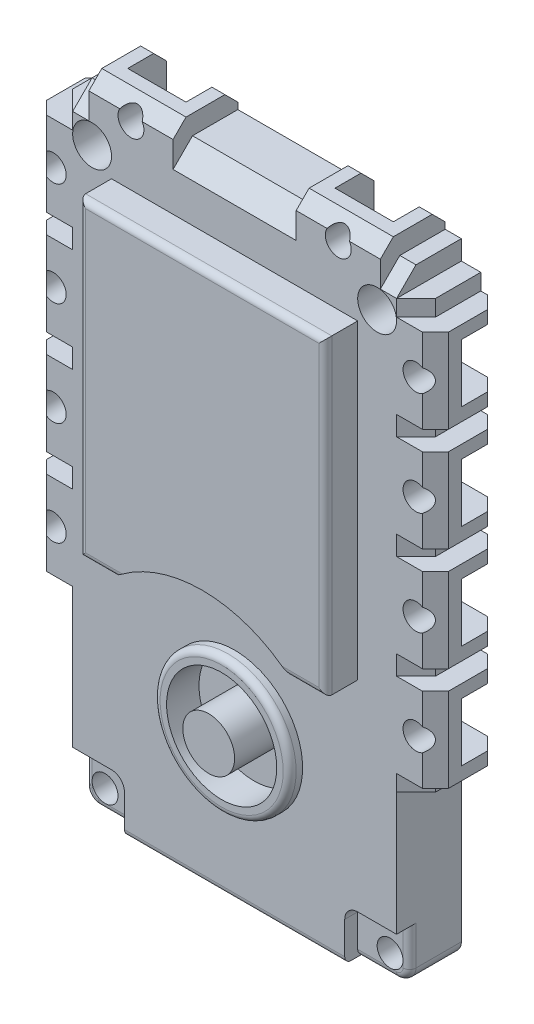
from build123d import *

# Parameters (mm, degrees)
BOSS_EXTRUDE1_DEPTH       = 5
BOSS_EXTRUDE2_DEPTH       = 1
SKETCH3_R                 = 5.25
SKETCH3_R_2               = 2
BOSS_EXTRUDE3_DEPTH       = 1
SKETCH4_R                 = 4.25
CUT_EXTRUDE1_DEPTH        = 0.5
FILLET3_R                 = 0.5
CUT_EXTRUDE2_START        = -11.5
SKETCH5_R                 = 2
CUT_EXTRUDE2_DEPTH        = 11.5
SKETCH6_W                 = 1.5
SKETCH6_H                 = 33
BOSS_EXTRUDE4_DEPTH       = 5
CUT_EXTRUDE3_DEPTH        = 61
SKETCH8_W                 = 3
SKETCH8_H                 = 6.5
SKETCH8_R                 = 1
BOSS_EXTRUDE5_DEPTH       = 5
CUT_EXTRUDE4_DEPTH        = 31
SKETCH10_R                = 1
CUT_EXTRUDE5_DEPTH        = 31
BOSS_EXTRUDE11_DEPTH      = 5
CUT_EXTRUDE6_DEPTH        = 25
SKETCH13_W                = 6.5
SKETCH13_H                = 3
SKETCH13_R                = 1
BOSS_EXTRUDE12_DEPTH      = 5
SKETCH15_R                = 1
CUT_EXTRUDE7_DEPTH        = 5
CUT_EXTRUDE8_DEPTH        = 23
CUT_EXTRUDE10_START       = -3
CUT_EXTRUDE10_OUTLINE_W   = 4.5
CUT_EXTRUDE10_OUTLINE_H   = 3
CUT_EXTRUDE10_OUTLINE_H_2 = 2
CUT_EXTRUDE10_DEPTH       = 3
SKETCH18_W                = 3
SKETCH18_H                = 4.5
CUT_EXTRUDE11_DEPTH       = 3
SKETCH19_W                = 4.5
SKETCH19_H                = 1
CUT_EXTRUDE12_DEPTH       = 3
SKETCH20_W                = 1
SKETCH20_H                = 4.5
SKETCH20_W_2              = 3
CUT_EXTRUDE13_DEPTH       = 3
SKETCH21_W                = 19
SKETCH21_H                = 24
BOSS_EXTRUDE13_DEPTH      = 2.5
SKETCH22_R                = 1.5
SKETCH22_R_2              = 1
CUT_EXTRUDE14_DEPTH       = 16.5
CUT_EXTRUDE15_DEPTH       = 1
SKETCH25_R                = 4.25
CUT_EXTRUDE16_DEPTH       = 2
SKETCH26_R                = 2
BOSS_EXTRUDE14_DEPTH      = 7
CUT_EXTRUDE17_DEPTH       = 1
CUT_EXTRUDE17_DEPTH_BACK  = 2
FILLET5_R                 = 0.5
FILLET6_R                 = 0.5
FILLET7_R                 = 0.5
FILLET8_R                 = 0.5


# Read off the part's stored shape, not the designer's step: Cut-Extrude10
with BuildPart() as part:
    # Sketch1 → Boss-Extrude1 (new body)
    with BuildSketch(Plane.XY):
        with BuildLine():
            Line((18.25, 1.5), (18.25, 0))
            Line((18.25, 0), (24, 0))
            ThreePointArc((24, 0), (24.707106781, -0.292893219), (25, -1))
            Line((25, -1), (25, -45.5))
            ThreePointArc((25, -45.5), (24.707106781, -46.207106781), (24, -46.5))
            Line((24, -46.5), (1, -46.5))
            ThreePointArc((1, -46.5), (0.292893219, -46.207106781), (0, -45.5))
            Line((0, -45.5), (0, -1))
            ThreePointArc((0, -1), (0.292893219, -0.292893219), (1, 0))
            Line((1, 0), (6.75, 0))
            Line((6.75, 0), (6.75, 1.5))
            Line((6.75, 1.5), (18.25, 1.5))
        make_face()
    extrude(amount=BOSS_EXTRUDE1_DEPTH)

    # Sketch2 → Boss-Extrude2 (add)
    with BuildSketch(Plane(origin=(0, 0, 0), x_dir=(-1, 0, 0), z_dir=(0, 0, -1))):
        with BuildLine():
            Line((-24, -2), (-24, -44.5))
            ThreePointArc((-24, -44.5), (-23.707106781, -45.207106781), (-23, -45.5))
            Line((-23, -45.5), (-2, -45.5))
            ThreePointArc((-2, -45.5), (-1.292893219, -45.207106781), (-1, -44.5))
            Line((-1, -44.5), (-1, -2))
            ThreePointArc((-1, -2), (-1.292893219, -1.292893219), (-2, -1))
            Line((-2, -1), (-23, -1))
            ThreePointArc((-23, -1), (-23.707106781, -1.292893219), (-24, -2))
        make_face()
        with BuildLine():
            Line((-23, -3), (-23, -43.5))
            ThreePointArc((-23, -43.5), (-22.707106781, -44.207106781), (-22, -44.5))
            Line((-22, -44.5), (-3, -44.5))
            ThreePointArc((-3, -44.5), (-2.292893219, -44.207106781), (-2, -43.5))
            Line((-2, -43.5), (-2, -3))
            ThreePointArc((-2, -3), (-2.292893219, -2.292893219), (-3, -2))
            Line((-3, -2), (-22, -2))
            ThreePointArc((-22, -2), (-22.707106781, -2.292893219), (-23, -3))
        make_face(mode=Mode.SUBTRACT)
    extrude(amount=BOSS_EXTRUDE2_DEPTH)

    # Sketch3 → Boss-Extrude3 (add)
    with BuildSketch(Plane.XY.offset(5)):
        with Locations(Location((12.5, -35, 0), (0, 0, 180))):
            Circle(SKETCH3_R)
        with Locations((12.5, -35)):
            Circle(SKETCH3_R_2, mode=Mode.SUBTRACT)
    extrude(amount=BOSS_EXTRUDE3_DEPTH)

    # Sketch4 → Cut-Extrude1 (cut)
    with BuildSketch(Plane.XY.offset(6)):
        with Locations((12.5, -35)):
            Circle(SKETCH4_R)
    extrude(amount=-CUT_EXTRUDE1_DEPTH, mode=Mode.SUBTRACT)

    # Fillet3
    fillet3_edges = [part.edges().sort_by_distance(p)[0] for p in [
        (17.75, -35, 6),
    ]]
    fillet(fillet3_edges, radius=FILLET3_R)

    # Sketch5 → Cut-Extrude2 (cut)
    with BuildSketch(Plane.XY.offset(5).offset(CUT_EXTRUDE2_START)):
        with Locations(Location((12.5, -35, 0), (0, 0, 180))):
            Circle(SKETCH5_R)
    extrude(amount=CUT_EXTRUDE2_DEPTH, mode=Mode.SUBTRACT)

    # Sketch6 → Boss-Extrude4 (add)
    with BuildSketch(Plane.XY.offset(5)):
        with Locations((25.75, -16.5)):
            Rectangle(SKETCH6_W, SKETCH6_H)
        with Locations((-0.75, -16.5)):
            Rectangle(SKETCH6_W, SKETCH6_H)
    extrude(amount=-BOSS_EXTRUDE4_DEPTH)

    # Sketch7 → Cut-Extrude3 (cut)
    with BuildSketch(Plane(origin=(0, 0, 0), x_dir=(-1, 0, 0), z_dir=(0, 1, 0))):
        Polygon((-26.5, 3.5), (-25, 5), (-26.5, 5), align=None)
        Polygon((1.5, 3.5), (0, 5), (1.5, 5), align=None)
    extrude(amount=-CUT_EXTRUDE3_DEPTH, mode=Mode.SUBTRACT)

    # Sketch8 → Boss-Extrude5 (add)
    # profile 1 of 8: a face of its own
    with BuildSketch(Plane.XY.offset(5)):
        with Locations((26.5, -28.5)):
            Rectangle(SKETCH8_W, SKETCH8_H)
        with Locations((26.5, -28.5)):
            Circle(SKETCH8_R, mode=Mode.SUBTRACT)
    # profile 2 of 8: a face of its own
    with BuildSketch(Plane.XY.offset(5)):
        with Locations((26.5, -20.5)):
            Rectangle(SKETCH8_W, SKETCH8_H)
        with Locations((26.5, -20.5)):
            Circle(SKETCH8_R, mode=Mode.SUBTRACT)
    # profile 3 of 8: a face of its own
    with BuildSketch(Plane.XY.offset(5)):
        with Locations((26.5, -12.5)):
            Rectangle(SKETCH8_W, SKETCH8_H)
        with Locations((26.5, -12.5)):
            Circle(SKETCH8_R, mode=Mode.SUBTRACT)
    # profile 4 of 8: a face of its own
    with BuildSketch(Plane.XY.offset(5)):
        with Locations((26.5, -4.5)):
            Rectangle(SKETCH8_W, SKETCH8_H)
        with Locations((26.5, -4.5)):
            Circle(SKETCH8_R, mode=Mode.SUBTRACT)
    # profile 5 of 8: a face of its own
    with BuildSketch(Plane.XY.offset(5)):
        with Locations((-1.5, -4.5)):
            Rectangle(SKETCH8_W, SKETCH8_H)
        with Locations(Location((-1.5, -4.5, 0), (0, 0, 90))):
            Circle(SKETCH8_R, mode=Mode.SUBTRACT)
    # profile 6 of 8: a face of its own
    with BuildSketch(Plane.XY.offset(5)):
        with Locations((-1.5, -12.5)):
            Rectangle(SKETCH8_W, SKETCH8_H)
        with Locations(Location((-1.5, -12.5, 0), (0, 0, 90))):
            Circle(SKETCH8_R, mode=Mode.SUBTRACT)
    # profile 7 of 8: a face of its own
    with BuildSketch(Plane.XY.offset(5)):
        with Locations((-1.5, -20.5)):
            Rectangle(SKETCH8_W, SKETCH8_H)
        with Locations(Location((-1.5, -20.5, 0), (0, 0, 90))):
            Circle(SKETCH8_R, mode=Mode.SUBTRACT)
    # profile 8 of 8: a face of its own
    with BuildSketch(Plane.XY.offset(5)):
        with Locations((-1.5, -28.5)):
            Rectangle(SKETCH8_W, SKETCH8_H)
        with Locations(Location((-1.5, -28.5, 0), (0, 0, 90))):
            Circle(SKETCH8_R, mode=Mode.SUBTRACT)
    extrude(amount=-BOSS_EXTRUDE5_DEPTH)

    # Sketch9 → Cut-Extrude4 (cut)
    with BuildSketch(Plane(origin=(0, -1.25, 0), x_dir=(-1, 0, 0), z_dir=(0, 1, 0))):
        Polygon((2, 5), (3, 4), (3, 5), align=None)
        Polygon((3, 1), (3, 0), (2, 0), align=None)
        Polygon((-27, 0), (-28, 0), (-28, 1), align=None)
        Polygon((-27, 5), (-28, 5), (-28, 4), align=None)
    extrude(amount=-CUT_EXTRUDE4_DEPTH, mode=Mode.SUBTRACT)

    # Sketch10 → Cut-Extrude5 (cut)
    with BuildSketch(Plane.XY.offset(5)):
        with Locations(Location((26.5, -28.5, 0), (0, 0, 300))):
            Circle(SKETCH10_R)
        with Locations(Location((26.5, -20.5, 0), (0, 0, 300))):
            Circle(SKETCH10_R)
        with Locations(Location((26.5, -12.5, 0), (0, 0, 300))):
            Circle(SKETCH10_R)
        with Locations(Location((26.5, -4.5, 0), (0, 0, 300))):
            Circle(SKETCH10_R)
        with Locations(Location((-1.5, -4.5, 0), (0, 0, 120))):
            Circle(SKETCH10_R)
        with Locations(Location((-1.5, -12.5, 0), (0, 0, 240))):
            Circle(SKETCH10_R)
        with Locations(Location((-1.5, -20.5, 0), (0, 0, 240))):
            Circle(SKETCH10_R)
        with Locations(Location((-1.5, -28.5, 0), (0, 0, 120))):
            Circle(SKETCH10_R)
    extrude(amount=-CUT_EXTRUDE5_DEPTH, mode=Mode.SUBTRACT)

    # Sketch11 → Boss-Extrude11 (add)
    with BuildSketch(Plane.XY.offset(5)):
        Polygon((25, 1.5), (0, 1.5), (0, 0), (0, -1.25), (25, -1.25), (25, 0), align=None)
    extrude(amount=-BOSS_EXTRUDE11_DEPTH)

    # Sketch12 → Cut-Extrude6 (cut)
    with BuildSketch(Plane.ZY):
        Polygon((3.5, 1.5), (5, 0), (5, 1.5), align=None)
    extrude(amount=-CUT_EXTRUDE6_DEPTH, mode=Mode.SUBTRACT)

    # Sketch13 → Boss-Extrude12 (add)
    # profile 1 of 2: a face of its own
    with BuildSketch(Plane.XY.offset(5)):
        with Locations((4.5, 1.5)):
            Rectangle(SKETCH13_W, SKETCH13_H)
        with Locations((4.5, 1.5)):
            Circle(SKETCH13_R, mode=Mode.SUBTRACT)
    # profile 2 of 2: a face of its own
    with BuildSketch(Plane.XY.offset(5)):
        with Locations((20.5, 1.5)):
            Rectangle(SKETCH13_W, SKETCH13_H)
        with Locations((20.5, 1.5)):
            Circle(SKETCH13_R, mode=Mode.SUBTRACT)
    extrude(amount=-BOSS_EXTRUDE12_DEPTH)

    # Sketch15 → Cut-Extrude7 (cut)
    with BuildSketch(Plane.XY.offset(5)):
        with Locations((4.5, 1.5)):
            Circle(SKETCH15_R)
        with Locations((20.5, 1.5)):
            Circle(SKETCH15_R)
    extrude(amount=-CUT_EXTRUDE7_DEPTH, mode=Mode.SUBTRACT)

    # Sketch16 → Cut-Extrude8 (cut)
    with BuildSketch(Plane(origin=(23.75, 0, 0), x_dir=(0, 0, -1), z_dir=(1, 0, 0))):
        Polygon((-4, 3), (-5, 2), (-5, 3), align=None)
        Polygon((-1, 3), (0, 3), (0, 2), align=None)
    extrude(amount=-CUT_EXTRUDE8_DEPTH, mode=Mode.SUBTRACT)

    # Cut-Extrude10 outline → Cut-Extrude10 (cut)
    with BuildSketch(Plane(origin=(0, 3, 0), x_dir=(-1, 0, 0), z_dir=(0, 1, 0)).offset(CUT_EXTRUDE10_START)):
        with Locations((-20.5, 1.5)):
            Rectangle(CUT_EXTRUDE10_OUTLINE_W, CUT_EXTRUDE10_OUTLINE_H)
        with Locations((-4.5, 2)):
            Rectangle(CUT_EXTRUDE10_OUTLINE_W, CUT_EXTRUDE10_OUTLINE_H_2)
    extrude(amount=CUT_EXTRUDE10_DEPTH, mode=Mode.SUBTRACT)

    # Sketch18 → Cut-Extrude11 (cut)
    with BuildSketch(Plane.ZY.offset(3)):
        with Locations((1.5, -4.5)):
            Rectangle(SKETCH18_W, SKETCH18_H)
        with Locations((1.5, -12.5)):
            Rectangle(SKETCH18_W, SKETCH18_H)
        with Locations((1.5, -20.5)):
            Rectangle(SKETCH18_W, SKETCH18_H)
        with Locations((1.5, -28.5)):
            Rectangle(SKETCH18_W, SKETCH18_H)
    extrude(amount=-CUT_EXTRUDE11_DEPTH, mode=Mode.SUBTRACT)

    # Sketch19 → Cut-Extrude12 (cut)
    with BuildSketch(Plane(origin=(0, 3, 0), x_dir=(-1, 0, 0), z_dir=(0, 1, 0))):
        with Locations((-4.5, 0.5)):
            Rectangle(SKETCH19_W, SKETCH19_H)
    extrude(amount=-CUT_EXTRUDE12_DEPTH, mode=Mode.SUBTRACT)

    # Sketch20 → Cut-Extrude13 (cut)
    with BuildSketch(Plane(origin=(28, 0, 0), x_dir=(0, 0, -1), z_dir=(1, 0, 0))):
        Polygon((-3, -10.25), (-3, -14.75), (-2, -14.75), (0, -14.75), (0, -10.25), (-2, -10.25), align=None)
        Polygon((-3, -18.25), (-3, -22.75), (-2, -22.75), (0, -22.75), (0, -18.25), (-2, -18.25), align=None)
        Polygon((-3, -26.25), (-3, -30.75), (-2, -30.75), (-1, -30.75), (-1, -26.25), (-2, -26.25), align=None)
        with Locations((-0.5, -28.5)):
            Rectangle(SKETCH20_W, SKETCH20_H)
        with Locations((-1.5, -4.5)):
            Rectangle(SKETCH20_W_2, SKETCH20_H)
    extrude(amount=-CUT_EXTRUDE13_DEPTH, mode=Mode.SUBTRACT)

    # Sketch21 → Boss-Extrude13 (add)
    with BuildSketch(Plane.XY.offset(5)):
        with Locations((12.5, -15)):
            Rectangle(SKETCH21_W, SKETCH21_H)
    extrude(amount=BOSS_EXTRUDE13_DEPTH)

    # Sketch22 → Cut-Extrude14 (cut)
    with BuildSketch(Plane.XY.offset(5)):
        with Locations((23.5, -1.5)):
            Circle(SKETCH22_R)
        with Locations(Location((1.5, -1.5, 0), (0, 0, 19.471220634))):
            Circle(SKETCH22_R)
        with Locations((23.5, -45)):
            Circle(SKETCH22_R_2)
        with Locations(Location((1.5, -45, 0), (0, 0, 330))):
            Circle(SKETCH22_R_2)
    extrude(amount=-CUT_EXTRUDE14_DEPTH, mode=Mode.SUBTRACT)

    # Sketch24 → Cut-Extrude15 (cut)
    with BuildSketch(Plane.XY.offset(5)):
        with BuildLine():
            Line((0, -42.5), (3, -42.5))
            ThreePointArc((3, -42.5), (3.707106781, -42.792893219), (4, -43.5))
            Line((4, -43.5), (4, -46.5))
            Line((4, -46.5), (0, -46.5))
            Line((0, -46.5), (0, -42.5))
        make_face()
        with BuildLine():
            Line((25, -46.5), (25, -42.5))
            Line((25, -42.5), (22, -42.5))
            ThreePointArc((22, -42.5), (21.292893219, -42.792893219), (21, -43.5))
            Line((21, -43.5), (21, -46.5))
            Line((21, -46.5), (25, -46.5))
        make_face()
    extrude(amount=-CUT_EXTRUDE15_DEPTH, mode=Mode.SUBTRACT)

    # Sketch25 → Cut-Extrude16 (cut)
    with BuildSketch(Plane.XY.offset(5.5)):
        with Locations((12.5, -35)):
            Circle(SKETCH25_R)
    extrude(amount=-CUT_EXTRUDE16_DEPTH, mode=Mode.SUBTRACT)

    # Sketch26 → Boss-Extrude14 (add)
    with BuildSketch(Plane(origin=(0, 0, 0), x_dir=(-1, 0, 0), z_dir=(0, 0, -1))):
        with Locations((-12.5, -35)):
            Circle(SKETCH26_R)
    extrude(amount=-BOSS_EXTRUDE14_DEPTH)

    # Sketch27 → Cut-Extrude17 (cut, two sides: drawn at the far end of the back side and taken through both)
    with BuildSketch(Plane.XY.offset(7).offset(-CUT_EXTRUDE17_DEPTH_BACK)):
        with BuildLine():
            Line((3.747536514, -29.199622173), (7.519798684, -29.199622173))
            ThreePointArc((7.519798684, -29.199622173), (12.5, -27.354950093), (17.480201316, -29.199622173))
            Line((17.480201316, -29.199622173), (21.252463486, -29.199622173))
            ThreePointArc((21.252463486, -29.199622173), (12.5, -24.5), (3.747536514, -29.199622173))
        make_face()
    extrude(amount=CUT_EXTRUDE17_DEPTH + CUT_EXTRUDE17_DEPTH_BACK, mode=Mode.SUBTRACT)

    # Fillet5
    fillet5_edges = [part.edges().sort_by_distance(p)[0] for p in [
        (22, -15, 7.5),
        (12.5, -3, 7.5),
        (3, -15, 7.5),
        (4.349632373, -27, 7.5),
        (20.650367627, -27, 7.5),
    ]]
    fillet(fillet5_edges, radius=FILLET5_R)

    # Fillet6
    fillet6_edges = [part.edges().sort_by_distance(p)[0] for p in [
        (12.5, -46.5, 5),
    ]]
    fillet(fillet6_edges, radius=FILLET6_R)

    # Fillet7
    fillet7_edges = [part.edges().sort_by_distance(p)[0] for p in [
        (25, -44, 4),
        (24.707106781, -46.207106781, 4),
        (22.5, -46.5, 4),
    ]]
    fillet(fillet7_edges, radius=FILLET7_R - 0.0001)  # a hair under: the kernel refuses the full size

    # Fillet8
    fillet8_edges = [part.edges().sort_by_distance(p)[0] for p in [
        (2.5, -46.5, 4),
        (0.292893219, -46.207106781, 4),
        (0, -44, 4),
    ]]
    fillet(fillet8_edges, radius=FILLET8_R - 0.0001)  # a hair under: the kernel refuses the full size


solid = part.part
